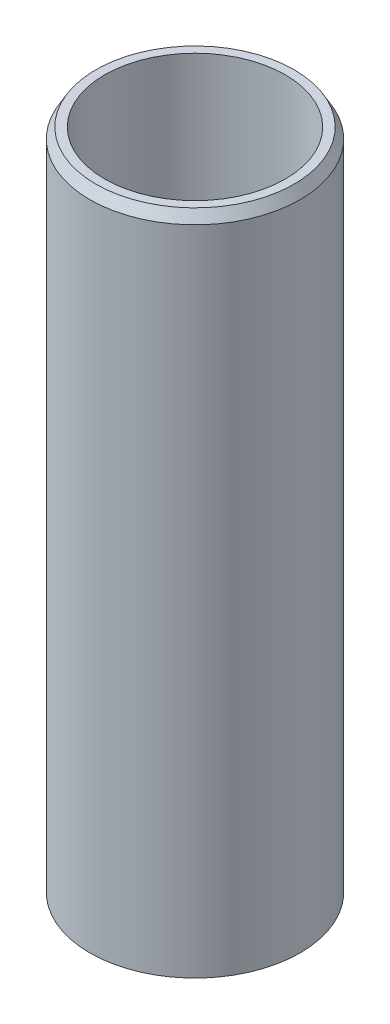
from build123d import *
from OCP.BRepFilletAPI import BRepFilletAPI_MakeChamfer

# Parameters (mm, degrees)
SKETCH1_R           = 57.5
BOSS_EXTRUDE1_DEPTH = 365.65184169
SKETCH2_R           = 49.375733645
CUT_EXTRUDE1_DEPTH  = 375.584795916
CHAMFER1_SIZE       = 5.705677935
CHAMFER1_SIZE2      = 3.294174692


with BuildPart() as part:
    # Sketch1 → Boss-Extrude1 (new body)
    with BuildSketch(Plane(origin=(0, 0, 0), x_dir=(1, 0, 0), z_dir=(0, 1, 0))):
        Circle(SKETCH1_R)
    extrude(amount=BOSS_EXTRUDE1_DEPTH)

    # Sketch2 → Cut-Extrude1 (cut, through all)
    with BuildSketch(Plane(origin=(0, 0, 0), x_dir=(1, 0, 0), z_dir=(0, 1, 0))):
        Circle(SKETCH2_R)
    extrude(amount=CUT_EXTRUDE1_DEPTH, mode=Mode.SUBTRACT)

    # Chamfer1: one chamfer whose edges measure the first distance from different faces: ONE call of the kernel's chamfer builder (chamfer() names one face for all edges)
    chamfer1_edges_1 = [part.edges().sort_by_distance(p)[0] for p in [
        (-57.5, 365.65184169, 0),
    ]]
    chamfer1_side_1 = [part.faces().sort_by_distance(p)[0] for p in [
        (-57.5, 182.825920845, 0),
    ]]
    chamfer1_edges_2 = [part.edges().sort_by_distance(p)[0] for p in [
        (-57.5, 0, 0),
    ]]
    chamfer1_side_2 = [part.faces().sort_by_distance(p)[0] for p in [
        (-55.873654403, 0, 0),
    ]]
    chamfer1 = BRepFilletAPI_MakeChamfer(part.part.solid().wrapped)
    for e in chamfer1_edges_1:
        chamfer1.Add(CHAMFER1_SIZE, CHAMFER1_SIZE2, e.wrapped, chamfer1_side_1[0].wrapped)  # the first distance lies on this face
    for e in chamfer1_edges_2:
        chamfer1.Add(CHAMFER1_SIZE, CHAMFER1_SIZE2, e.wrapped, chamfer1_side_2[0].wrapped)  # the first distance lies on this face
    add(Compound.cast(chamfer1.Shape()), mode=Mode.REPLACE)


solid = part.part
